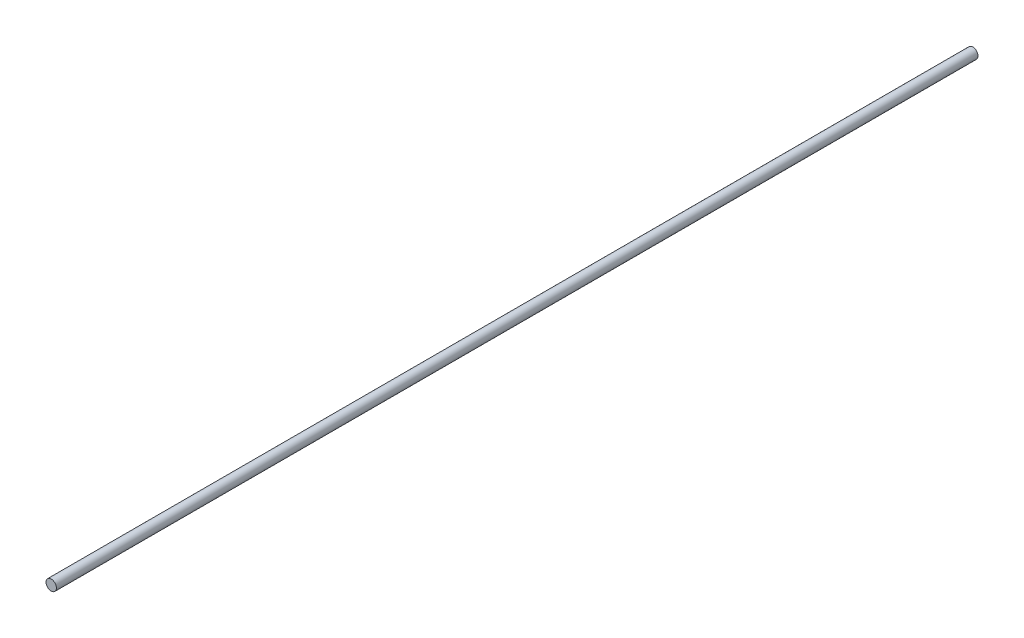
from build123d import *

# Parameters (mm, degrees)
SKETCH1_R           = 7.9375
BOSS_EXTRUDE1_DEPTH = 2254.25
SKETCH2_R           = 7.9375
CUT_EXTRUDE1_DEPTH  = 596.9
CUT_EXTRUDE2_START  = -254
SKETCH3_R           = 7.9375
CUT_EXTRUDE2_DEPTH  = 254


with BuildPart() as part:
    # Sketch1 → Boss-Extrude1 (new body)
    with BuildSketch(Plane.XY):
        Circle(SKETCH1_R)
    extrude(amount=BOSS_EXTRUDE1_DEPTH)

    # Sketch2 → Cut-Extrude1 (cut)
    with BuildSketch(Plane(origin=(0, 0, 0), x_dir=(-1, 0, 0), z_dir=(0, 0, -1))):
        Circle(SKETCH2_R)
    extrude(amount=-CUT_EXTRUDE1_DEPTH, mode=Mode.SUBTRACT)

    # Sketch3 → Cut-Extrude2 (cut)
    with BuildSketch(Plane.XY.offset(2254.25).offset(CUT_EXTRUDE2_START)):
        Circle(SKETCH3_R)
    extrude(amount=CUT_EXTRUDE2_DEPTH, mode=Mode.SUBTRACT)


solid = part.part
